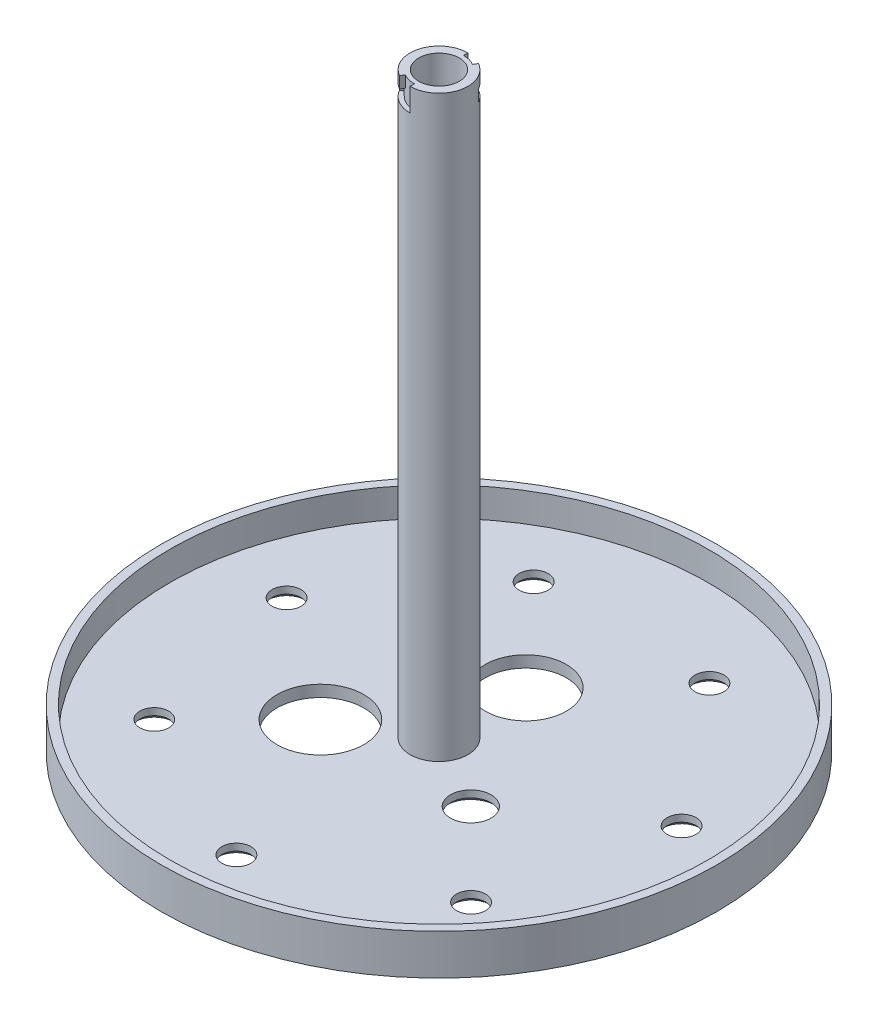
from build123d import *

# Parameters (mm, degrees)
SKETCH1_R                = 46.5
SKETCH1_R_2              = 7
SKETCH1_R_3              = 7.5
SKETCH1_R_4              = 3.5
BOSS_EXTRUDE1_DEPTH      = 2
SKETCH3_R                = 5
SKETCH3_R_2              = 3.5
BOSS_EXTRUDE2_DEPTH      = 100
CUT_EXTRUDE2_REACH       = 123.361
SKETCH6_R                = 2.5
CHAMFER2_SIZE            = 0.8
SKETCH7_W                = 0.75
SKETCH7_H                = 2
CUT_REVOLVE1_ANGLE       = 30
SKETCH7_4_W              = 0.75
SKETCH7_4_H              = 2
CUT_REVOLVE2_ANGLE       = 60
CIRPATTERN5_COUNT        = 2
BOSS_EXTRUDE3_DEPTH      = 5
BOSS_EXTRUDE3_DEPTH_BACK = 2
SKETCH8_R                = 48
SKETCH8_R_2              = 46.5


with BuildPart() as part:
    # Sketch1 → Boss-Extrude1 (new body)
    with BuildSketch(Plane(origin=(0, 0, 0), x_dir=(1, 0, 0), z_dir=(0, 1, 0))):
        Circle(SKETCH1_R)
        with Locations((0, 15)):
            Circle(SKETCH1_R_2, mode=Mode.SUBTRACT)
        with Locations((-12.990381057, -7.5)):
            Circle(SKETCH1_R_3, mode=Mode.SUBTRACT)
        with Locations((12.990381057, -7.5)):
            Circle(SKETCH1_R_4, mode=Mode.SUBTRACT)
        Circle(SKETCH1_R_4, mode=Mode.SUBTRACT)
    extrude(amount=BOSS_EXTRUDE1_DEPTH)

    # Sketch3 → Boss-Extrude2 (add)
    with BuildSketch(Plane(origin=(0, 2, 0), x_dir=(1, 0, 0), z_dir=(0, 1, 0))):
        Circle(SKETCH3_R)
        Circle(SKETCH3_R_2, mode=Mode.SUBTRACT)
    extrude(amount=BOSS_EXTRUDE2_DEPTH)

    # Sketch6 → Cut-Extrude2 (cut, up to next)
    with BuildSketch(Plane.XZ, mode=Mode.PRIVATE) as cut_extrude2_sk1:
        with Locations((27.364101886, 21.822143065)):
            Circle(SKETCH6_R)
    cut_extrude2_tool1 = extrude(cut_extrude2_sk1.sketch, amount=-CUT_EXTRUDE2_REACH, mode=Mode.PRIVATE) & part.part
    # Sketch6 → Cut-Extrude2 (cut, up to next)
    with BuildSketch(Plane.XZ, mode=Mode.PRIVATE) as cut_extrude2_sk2:
        with Locations((34.122476926, -7.788232688)):
            Circle(SKETCH6_R)
    cut_extrude2_tool2 = extrude(cut_extrude2_sk2.sketch, amount=-CUT_EXTRUDE2_REACH, mode=Mode.PRIVATE) & part.part
    # Sketch6 → Cut-Extrude2 (cut, up to next)
    with BuildSketch(Plane.XZ, mode=Mode.PRIVATE) as cut_extrude2_sk3:
        with Locations((0, 35)):
            Circle(SKETCH6_R)
    cut_extrude2_tool3 = extrude(cut_extrude2_sk3.sketch, amount=-CUT_EXTRUDE2_REACH, mode=Mode.PRIVATE) & part.part
    # Sketch6 → Cut-Extrude2 (cut, up to next)
    with BuildSketch(Plane.XZ, mode=Mode.PRIVATE) as cut_extrude2_sk4:
        with Locations((15.185930869, -31.533910377)):
            Circle(SKETCH6_R)
    cut_extrude2_tool4 = extrude(cut_extrude2_sk4.sketch, amount=-CUT_EXTRUDE2_REACH, mode=Mode.PRIVATE) & part.part
    # Sketch6 → Cut-Extrude2 (cut, up to next)
    with BuildSketch(Plane.XZ, mode=Mode.PRIVATE) as cut_extrude2_sk5:
        with Locations((-27.364101886, 21.822143065)):
            Circle(SKETCH6_R)
    cut_extrude2_tool5 = extrude(cut_extrude2_sk5.sketch, amount=-CUT_EXTRUDE2_REACH, mode=Mode.PRIVATE) & part.part
    # Sketch6 → Cut-Extrude2 (cut, up to next)
    with BuildSketch(Plane.XZ, mode=Mode.PRIVATE) as cut_extrude2_sk6:
        with Locations((-15.185930869, -31.533910377)):
            Circle(SKETCH6_R)
    cut_extrude2_tool6 = extrude(cut_extrude2_sk6.sketch, amount=-CUT_EXTRUDE2_REACH, mode=Mode.PRIVATE) & part.part
    # Sketch6 → Cut-Extrude2 (cut, up to next)
    with BuildSketch(Plane.XZ, mode=Mode.PRIVATE) as cut_extrude2_sk7:
        with Locations((-34.122476926, -7.788232688)):
            Circle(SKETCH6_R)
    cut_extrude2_tool7 = extrude(cut_extrude2_sk7.sketch, amount=-CUT_EXTRUDE2_REACH, mode=Mode.PRIVATE) & part.part
    add(cut_extrude2_tool1.solids().sort_by_distance((27.364102, 0, 21.822143))[0], mode=Mode.SUBTRACT)
    add(cut_extrude2_tool2.solids().sort_by_distance((34.122477, 0, -7.788233))[0], mode=Mode.SUBTRACT)
    add(cut_extrude2_tool3.solids().sort_by_distance((0, 0, 35))[0], mode=Mode.SUBTRACT)
    add(cut_extrude2_tool4.solids().sort_by_distance((15.185931, 0, -31.53391))[0], mode=Mode.SUBTRACT)
    add(cut_extrude2_tool5.solids().sort_by_distance((-27.364102, 0, 21.822143))[0], mode=Mode.SUBTRACT)
    add(cut_extrude2_tool6.solids().sort_by_distance((-15.185931, 0, -31.53391))[0], mode=Mode.SUBTRACT)
    add(cut_extrude2_tool7.solids().sort_by_distance((-34.122477, 0, -7.788233))[0], mode=Mode.SUBTRACT)

    # Chamfer2
    chamfer2_edges = [part.edges().sort_by_distance(p)[0] for p in [
        (-2.5, 0, 35),
        (-29.864101886, 0, 21.822143065),
        (-36.622476926, 0, -7.788232688),
        (-17.685930869, 0, -31.533910377),
        (24.864101886, 0, 21.822143065),
        (9.490381057, 0, 7.5),
        (31.622476926, 0, -7.788232688),
        (12.685930869, 0, -31.533910377),
    ]]
    chamfer(chamfer2_edges, length=CHAMFER2_SIZE)

    # Sketch7 → Cut-Revolve1 (revolve, cut)
    with BuildSketch(Plane(origin=(0, 0, 0), x_dir=(0, 0, -1), z_dir=(1, 0, 0))):
        with Locations((4.625, 101)):
            Rectangle(SKETCH7_W, SKETCH7_H)
    cut_revolve1 = revolve(axis=Axis((0, 102, 0), (0, -1, 0)), revolution_arc=CUT_REVOLVE1_ANGLE, mode=Mode.SUBTRACT)

    # Sketch7<4> → Cut-Revolve2 (revolve, cut)
    with BuildSketch(Plane(origin=(0, 0, 0), x_dir=(0, 0, -1), z_dir=(1, 0, 0))):
        with Locations((4.625, 99)):
            Rectangle(SKETCH7_4_W, SKETCH7_4_H)
    cut_revolve2 = revolve(axis=Axis((0, 102, 0), (0, -1, 0)), revolution_arc=CUT_REVOLVE2_ANGLE, mode=Mode.SUBTRACT)

    # CirPattern5: Cut-Revolve1, Cut-Revolve2 ×2 about axis
    cirpattern5_axis = Axis((0, 102, 0), (0, -1, 0))
    add([cut_revolve1.rotate(cirpattern5_axis, i * 360 / CIRPATTERN5_COUNT) for i in range(1, CIRPATTERN5_COUNT)], mode=Mode.SUBTRACT)
    add([cut_revolve2.rotate(cirpattern5_axis, i * 360 / CIRPATTERN5_COUNT) for i in range(1, CIRPATTERN5_COUNT)], mode=Mode.SUBTRACT)


with BuildPart() as body_2:
    # Sketch8 → Boss-Extrude3 (new, two sides: drawn at the far end of the back side and taken through both)
    with BuildSketch(Plane(origin=(0, 2, 0), x_dir=(1, 0, 0), z_dir=(0, 1, 0)).offset(-BOSS_EXTRUDE3_DEPTH_BACK)):
        Circle(SKETCH8_R)
        Circle(SKETCH8_R_2, mode=Mode.SUBTRACT)
    extrude(amount=BOSS_EXTRUDE3_DEPTH + BOSS_EXTRUDE3_DEPTH_BACK)


solid = Compound([part.part, body_2.part])
